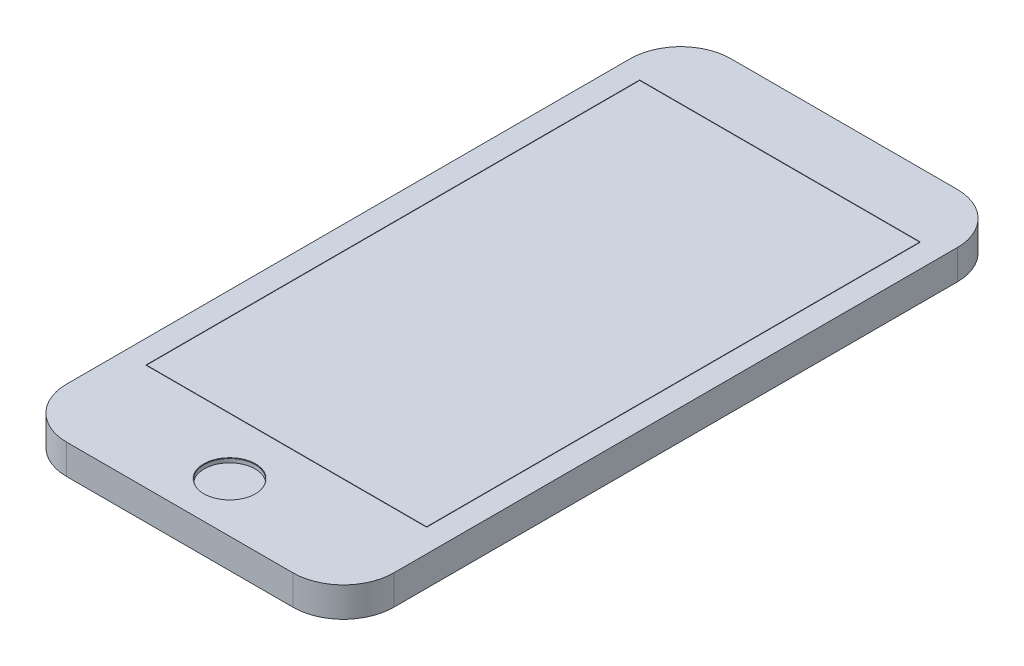
from build123d import *

# Parameters (mm, degrees)
EXTRUDE_1_DEPTH       = 7.1
SKETCH_2_R            = 6.07081667
CUT_EXTRUDE_1_DEPTH   = 1
SKETCH_2_4_R          = 6.17081667
SKETCH_2_4_R_2        = 6.07081667
SKETCH_2_4_W          = 66.885632048
SKETCH_2_4_H          = 117.633817445
SKETCH_2_4_W_2        = 66.685632048
SKETCH_2_4_H_2        = 117.433817445
CUT_EXTRUDE_1_2_DEPTH = 0.1


with BuildPart() as part:
    # Эскиз1 → Бобышка-Вытянуть1 (new body)
    with BuildSketch(Plane(origin=(0, 0, 0), x_dir=(1, 0, 0), z_dir=(0, 1, 0))):
        with BuildLine():
            Line((26.95, 79.1), (-26.95, 79.1))
            ThreePointArc((-26.95, 79.1), (-35.435281374, 75.585281374), (-38.95, 67.1))
            Line((-38.95, 67.1), (-38.95, -67.1))
            ThreePointArc((-38.95, -67.1), (-35.435281374, -75.585281374), (-26.95, -79.1))
            Line((-26.95, -79.1), (26.95, -79.1))
            ThreePointArc((26.95, -79.1), (35.435281374, -75.585281374), (38.95, -67.1))
            Line((38.95, -67.1), (38.95, 67.1))
            ThreePointArc((38.95, 67.1), (35.435281374, 75.585281374), (26.95, 79.1))
        make_face()
    extrude(amount=EXTRUDE_1_DEPTH)

    # Эскиз2 → Cut-Extrude 1 (cut)
    with BuildSketch(Plane(origin=(0, 7.1, 0), x_dir=(1, 0, 0), z_dir=(0, 1, 0))):
        with Locations((0, -67.251539846)):
            Circle(SKETCH_2_R)
    extrude(amount=-CUT_EXTRUDE_1_DEPTH, mode=Mode.SUBTRACT)

    # Эскиз2<4> → Cut-Extrude 1 2 (cut)
    # profile 1 of 2: a face of its own
    with BuildSketch(Plane(origin=(0, 7.1, 0), x_dir=(1, 0, 0), z_dir=(0, 1, 0))):
        with Locations((0, -67.251539846)):
            Circle(SKETCH_2_4_R)
        with Locations((0, -67.251539846)):
            Circle(SKETCH_2_4_R_2, mode=Mode.SUBTRACT)
    # profile 2 of 2: a face of its own
    with BuildSketch(Plane(origin=(0, 7.1, 0), x_dir=(1, 0, 0), z_dir=(0, 1, 0))):
        with Locations((0, 5.032877891)):
            Rectangle(SKETCH_2_4_W, SKETCH_2_4_H)
        with Locations((0, 5.032877891)):
            Rectangle(SKETCH_2_4_W_2, SKETCH_2_4_H_2, mode=Mode.SUBTRACT)
    extrude(amount=-CUT_EXTRUDE_1_2_DEPTH, mode=Mode.SUBTRACT)


solid = part.part
